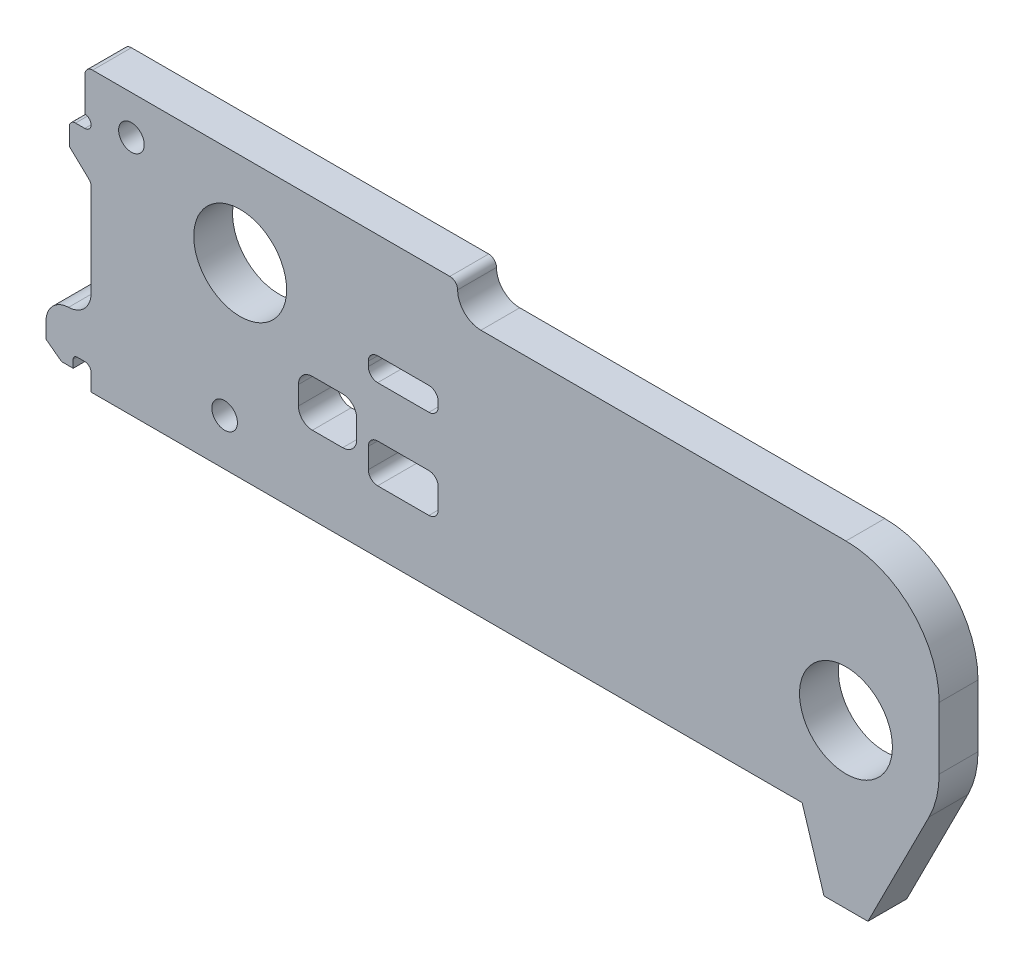
from build123d import *

# Parameters (mm, degrees)
SKETCH1_R           = 5.98
SKETCH1_R_2         = 1.65
SKETCH1_W           = 9
SKETCH1_H           = 5
SKETCH1_H_2         = 3
SKETCH1_W_2         = 7.5
SKETCH1_H_3         = 6
BOSS_EXTRUDE1_DEPTH = 5
FILLET1_R           = 1.2
FILLET2_R           = 3
FILLET3_R           = 1
FILLET5_R           = 1.8
FILLET6_R           = 0.8
FILLET7_R           = 3


with BuildPart() as part:
    # Sketch1 → Boss-Extrude1 (new body)
    with BuildSketch(Plane.XY):
        with BuildLine():
            Line((72.356568311, -24), (75.172081726, -33))
            Line((75.172081726, -33), (80.827918274, -33))
            Line((80.827918274, -33), (88.70873293, -17.415075165))
            ThreePointArc((88.70873293, -17.415075165), (89.67272023, -14.78345153), (90, -12))
            Line((90, -12), (90, -4))
            ThreePointArc((90, -4), (86.485281374, 4.485281374), (78, 8))
            Line((78, 8), (28, 8))
            Line((28, 8), (28, 12))
            Line((28, 12), (-20, 12))
            Line((-20, 12), (-20, 6.6))
            ThreePointArc((-20, 6.6), (-19.2, 5.8), (-20, 5))
            Line((-20, 5), (-22, 5))
            Line((-22, 5), (-22, 2))
            Line((-22, 2), (-19.449413077, -0.419608718))
            ThreePointArc((-19.449413077, -0.419608718), (-19.264993354, -0.684143655), (-19.2, -1))
            Line((-19.2, -1), (-19.2, -13))
            ThreePointArc((-19.2, -13), (-20.078679656, -15.121320344), (-22.2, -16))
            Line((-22.2, -16), (-25, -16))
            Line((-25, -16), (-25, -21))
            Line((-25, -21), (-23, -22.5))
            Line((-23, -22.5), (-21.5, -22.5))
            Line((-21.5, -22.5), (-21.5, -21.5))
            ThreePointArc((-21.5, -21.5), (-21.353553391, -21.146446609), (-21, -21))
            Line((-21, -21), (-20, -21))
            ThreePointArc((-20, -21), (-19.434314575, -21.234314575), (-19.2, -21.8))
            Line((-19.2, -21.8), (-19.2, -24))
            Line((-19.2, -24), (72.356568311, -24))
        make_face()
        Circle(SKETCH1_R, mode=Mode.SUBTRACT)
        with Locations((78, -12)):
            Circle(SKETCH1_R, mode=Mode.SUBTRACT)
        with Locations((-14, 7)):
            Circle(SKETCH1_R_2, mode=Mode.SUBTRACT)
        with Locations((-2, -18)):
            Circle(SKETCH1_R_2, mode=Mode.SUBTRACT)
        with Locations((21, -13.5)):
            Rectangle(SKETCH1_W, SKETCH1_H, mode=Mode.SUBTRACT)
        with Locations((21, -3)):
            Rectangle(SKETCH1_W, SKETCH1_H_2, mode=Mode.SUBTRACT)
        with Locations((11.25, -11)):
            Rectangle(SKETCH1_W_2, SKETCH1_H_3, mode=Mode.SUBTRACT)
    extrude(amount=BOSS_EXTRUDE1_DEPTH)

    # Fillet1
    fillet1_edges = [part.edges().sort_by_distance(p)[0] for p in [
        (16.5, -11, 2.5),
        (16.5, -16, 2.5),
        (25.5, -16, 2.5),
        (25.5, -11, 2.5),
        (16.5, -1.5, 2.5),
        (16.5, -4.5, 2.5),
        (25.5, -4.5, 2.5),
        (25.5, -1.5, 2.5),
    ]]
    fillet(fillet1_edges, radius=FILLET1_R)

    # Fillet2
    fillet2_edges = [part.edges().sort_by_distance(p)[0] for p in [
        (28, 8, 2.5),
    ]]
    fillet(fillet2_edges, radius=FILLET2_R)

    # Fillet3
    fillet3_edges = [part.edges().sort_by_distance(p)[0] for p in [
        (28, 12, 2.5),
        (-20, 12, 2.5),
    ]]
    fillet(fillet3_edges, radius=FILLET3_R - 0.0001)  # a hair under: the kernel refuses the full size

    # Fillet5
    fillet5_edges = [part.edges().sort_by_distance(p)[0] for p in [
        (7.5, -8, 2.5),
        (7.5, -14, 2.5),
        (15, -14, 2.5),
        (15, -8, 2.5),
    ]]
    fillet(fillet5_edges, radius=FILLET5_R)

    # Fillet6
    fillet6_edges = [part.edges().sort_by_distance(p)[0] for p in [
        (-22, 5, 2.5),
    ]]
    fillet(fillet6_edges, radius=FILLET6_R)

    # Fillet7
    fillet7_edges = [part.edges().sort_by_distance(p)[0] for p in [
        (-25, -16, 2.5),
    ]]
    fillet(fillet7_edges, radius=FILLET7_R)


solid = part.part
